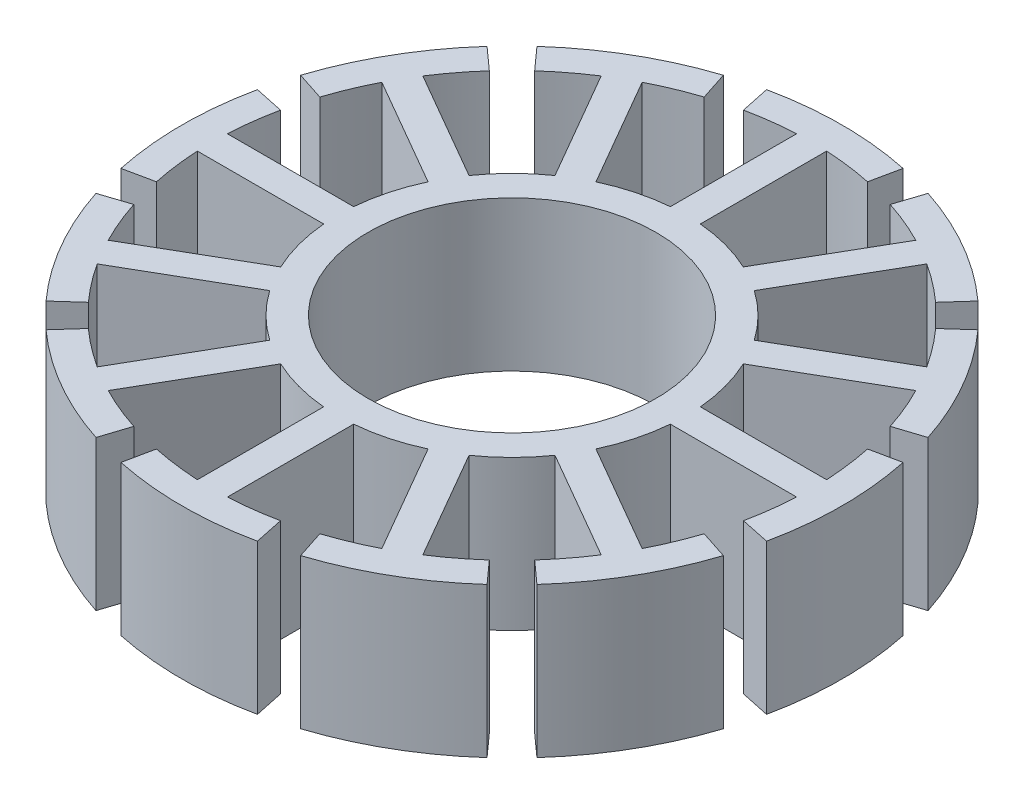
from build123d import *

# Parameters (mm, degrees)
SKETCH1_R           = 4.8
BOSS_EXTRUDE1_DEPTH = 5


with BuildPart() as part:
    # Sketch1 → Boss-Extrude1 (new body)
    with BuildSketch(Plane(origin=(0, 0, 0), x_dir=(1, 0, 0), z_dir=(0, 1, 0))):
        with BuildLine():
            ThreePointArc((2.275, 10.76217334), (0, 11), (-2.275, 10.76217334))
            Line((-2.275, 10.76217334), (-2.068181818, 9.783793945))
            ThreePointArc((-2.068181818, 9.783793945), (-1.288123715, 9.916689836), (-0.5, 9.987492178))
            Line((-0.5, 9.987492178), (-0.5, 5.778408085))
            ThreePointArc((-0.5, 5.778408085), (-1.501150462, 5.602369792), (-2.456191341, 5.254248195))
            Line((-2.456191341, 5.254248195), (-4.560733387, 8.899421946))
            ThreePointArc((-4.560733387, 8.899421946), (-3.842797057, 9.232167177), (-3.100798979, 9.507105011))
            Line((-3.100798979, 9.507105011), (-3.410878876, 10.457815512))
            ThreePointArc((-3.410878876, 10.457815512), (-5.5, 9.526279442), (-7.351294464, 8.182815512))
            Line((-7.351294464, 8.182815512), (-6.682994967, 7.438923193))
            ThreePointArc((-6.682994967, 7.438923193), (-6.073892778, 7.944043462), (-5.426758791, 8.399421946))
            Line((-5.426758791, 8.399421946), (-3.322216745, 4.754248195))
            ThreePointArc((-3.322216745, 4.754248195), (-4.101219331, 4.101219331), (-4.754248195, 3.322216745))
            Line((-4.754248195, 3.322216745), (-8.399421946, 5.426758791))
            ThreePointArc((-8.399421946, 5.426758791), (-7.944043462, 6.073892778), (-7.438923193, 6.682994967))
            Line((-7.438923193, 6.682994967), (-8.182815512, 7.351294464))
            ThreePointArc((-8.182815512, 7.351294464), (-9.526279442, 5.5), (-10.457815512, 3.410878876))
            Line((-10.457815512, 3.410878876), (-9.507105011, 3.100798979))
            ThreePointArc((-9.507105011, 3.100798979), (-9.232167177, 3.842797057), (-8.899421946, 4.560733387))
            Line((-8.899421946, 4.560733387), (-5.254248195, 2.456191341))
            ThreePointArc((-5.254248195, 2.456191341), (-5.602369792, 1.501150462), (-5.778408085, 0.5))
            Line((-5.778408085, 0.5), (-9.987492178, 0.5))
            ThreePointArc((-9.987492178, 0.5), (-9.916689836, 1.288123715), (-9.783793945, 2.068181818))
            Line((-9.783793945, 2.068181818), (-10.76217334, 2.275))
            ThreePointArc((-10.76217334, 2.275), (-11, 0), (-10.76217334, -2.275))
            Line((-10.76217334, -2.275), (-9.783793945, -2.068181818))
            ThreePointArc((-9.783793945, -2.068181818), (-9.916689836, -1.288123715), (-9.987492178, -0.5))
            Line((-9.987492178, -0.5), (-5.778408085, -0.5))
            ThreePointArc((-5.778408085, -0.5), (-5.602369792, -1.501150462), (-5.254248195, -2.456191341))
            Line((-5.254248195, -2.456191341), (-8.899421946, -4.560733387))
            ThreePointArc((-8.899421946, -4.560733387), (-9.232167177, -3.842797057), (-9.507105011, -3.100798979))
            Line((-9.507105011, -3.100798979), (-10.457815512, -3.410878876))
            ThreePointArc((-10.457815512, -3.410878876), (-9.526279442, -5.5), (-8.182815512, -7.351294464))
            Line((-8.182815512, -7.351294464), (-7.438923193, -6.682994967))
            ThreePointArc((-7.438923193, -6.682994967), (-7.944043462, -6.073892778), (-8.399421946, -5.426758791))
            Line((-8.399421946, -5.426758791), (-4.754248195, -3.322216745))
            ThreePointArc((-4.754248195, -3.322216745), (-4.101219331, -4.101219331), (-3.322216745, -4.754248195))
            Line((-3.322216745, -4.754248195), (-5.426758791, -8.399421946))
            ThreePointArc((-5.426758791, -8.399421946), (-6.073892778, -7.944043462), (-6.682994967, -7.438923193))
            Line((-6.682994967, -7.438923193), (-7.351294464, -8.182815512))
            ThreePointArc((-7.351294464, -8.182815512), (-5.5, -9.526279442), (-3.410878876, -10.457815512))
            Line((-3.410878876, -10.457815512), (-3.100798979, -9.507105011))
            ThreePointArc((-3.100798979, -9.507105011), (-3.842797057, -9.232167177), (-4.560733387, -8.899421946))
            Line((-4.560733387, -8.899421946), (-2.456191341, -5.254248195))
            ThreePointArc((-2.456191341, -5.254248195), (-1.501150462, -5.602369792), (-0.5, -5.778408085))
            Line((-0.5, -5.778408085), (-0.5, -9.987492178))
            ThreePointArc((-0.5, -9.987492178), (-1.288123715, -9.916689836), (-2.068181818, -9.783793945))
            Line((-2.068181818, -9.783793945), (-2.275, -10.76217334))
            ThreePointArc((-2.275, -10.76217334), (0, -11), (2.275, -10.76217334))
            Line((2.275, -10.76217334), (2.068181818, -9.783793945))
            ThreePointArc((2.068181818, -9.783793945), (1.288123715, -9.916689836), (0.5, -9.987492178))
            Line((0.5, -9.987492178), (0.5, -5.778408085))
            ThreePointArc((0.5, -5.778408085), (1.501150462, -5.602369792), (2.456191341, -5.254248195))
            Line((2.456191341, -5.254248195), (4.560733387, -8.899421946))
            ThreePointArc((4.560733387, -8.899421946), (3.842797057, -9.232167177), (3.100798979, -9.507105011))
            Line((3.100798979, -9.507105011), (3.410878876, -10.457815512))
            ThreePointArc((3.410878876, -10.457815512), (5.5, -9.526279442), (7.351294464, -8.182815512))
            Line((7.351294464, -8.182815512), (6.682994967, -7.438923193))
            ThreePointArc((6.682994967, -7.438923193), (6.073892778, -7.944043462), (5.426758791, -8.399421946))
            Line((5.426758791, -8.399421946), (3.322216745, -4.754248195))
            ThreePointArc((3.322216745, -4.754248195), (4.101219331, -4.101219331), (4.754248195, -3.322216745))
            Line((4.754248195, -3.322216745), (8.399421946, -5.426758791))
            ThreePointArc((8.399421946, -5.426758791), (7.944043462, -6.073892778), (7.438923193, -6.682994967))
            Line((7.438923193, -6.682994967), (8.182815512, -7.351294464))
            ThreePointArc((8.182815512, -7.351294464), (9.526279442, -5.5), (10.457815512, -3.410878876))
            Line((10.457815512, -3.410878876), (9.507105011, -3.100798979))
            ThreePointArc((9.507105011, -3.100798979), (9.232167177, -3.842797057), (8.899421946, -4.560733387))
            Line((8.899421946, -4.560733387), (5.254248195, -2.456191341))
            ThreePointArc((5.254248195, -2.456191341), (5.602369792, -1.501150462), (5.778408085, -0.5))
            Line((5.778408085, -0.5), (9.987492178, -0.5))
            ThreePointArc((9.987492178, -0.5), (9.916689836, -1.288123715), (9.783793945, -2.068181818))
            Line((9.783793945, -2.068181818), (10.76217334, -2.275))
            ThreePointArc((10.76217334, -2.275), (11, 0), (10.76217334, 2.275))
            Line((10.76217334, 2.275), (9.783793945, 2.068181818))
            ThreePointArc((9.783793945, 2.068181818), (9.916689836, 1.288123715), (9.987492178, 0.5))
            Line((9.987492178, 0.5), (5.778408085, 0.5))
            ThreePointArc((5.778408085, 0.5), (5.602369792, 1.501150462), (5.254248195, 2.456191341))
            Line((5.254248195, 2.456191341), (8.899421946, 4.560733387))
            ThreePointArc((8.899421946, 4.560733387), (9.232167177, 3.842797057), (9.507105011, 3.100798979))
            Line((9.507105011, 3.100798979), (10.457815512, 3.410878876))
            ThreePointArc((10.457815512, 3.410878876), (9.526279442, 5.5), (8.182815512, 7.351294464))
            Line((8.182815512, 7.351294464), (7.438923193, 6.682994967))
            ThreePointArc((7.438923193, 6.682994967), (7.944043462, 6.073892778), (8.399421946, 5.426758791))
            Line((8.399421946, 5.426758791), (4.754248195, 3.322216745))
            ThreePointArc((4.754248195, 3.322216745), (4.101219331, 4.101219331), (3.322216745, 4.754248195))
            Line((3.322216745, 4.754248195), (5.426758791, 8.399421946))
            ThreePointArc((5.426758791, 8.399421946), (6.073892778, 7.944043462), (6.682994967, 7.438923193))
            Line((6.682994967, 7.438923193), (7.351294464, 8.182815512))
            ThreePointArc((7.351294464, 8.182815512), (5.5, 9.526279442), (3.410878876, 10.457815512))
            Line((3.410878876, 10.457815512), (3.100798979, 9.507105011))
            ThreePointArc((3.100798979, 9.507105011), (3.842797057, 9.232167177), (4.560733387, 8.899421946))
            Line((4.560733387, 8.899421946), (2.456191341, 5.254248195))
            ThreePointArc((2.456191341, 5.254248195), (1.501150462, 5.602369792), (0.5, 5.778408085))
            Line((0.5, 5.778408085), (0.5, 9.987492178))
            ThreePointArc((0.5, 9.987492178), (1.288123715, 9.916689836), (2.068181818, 9.783793945))
            Line((2.068181818, 9.783793945), (2.275, 10.76217334))
        make_face()
        Circle(SKETCH1_R, mode=Mode.SUBTRACT)
    extrude(amount=BOSS_EXTRUDE1_DEPTH)


solid = part.part
